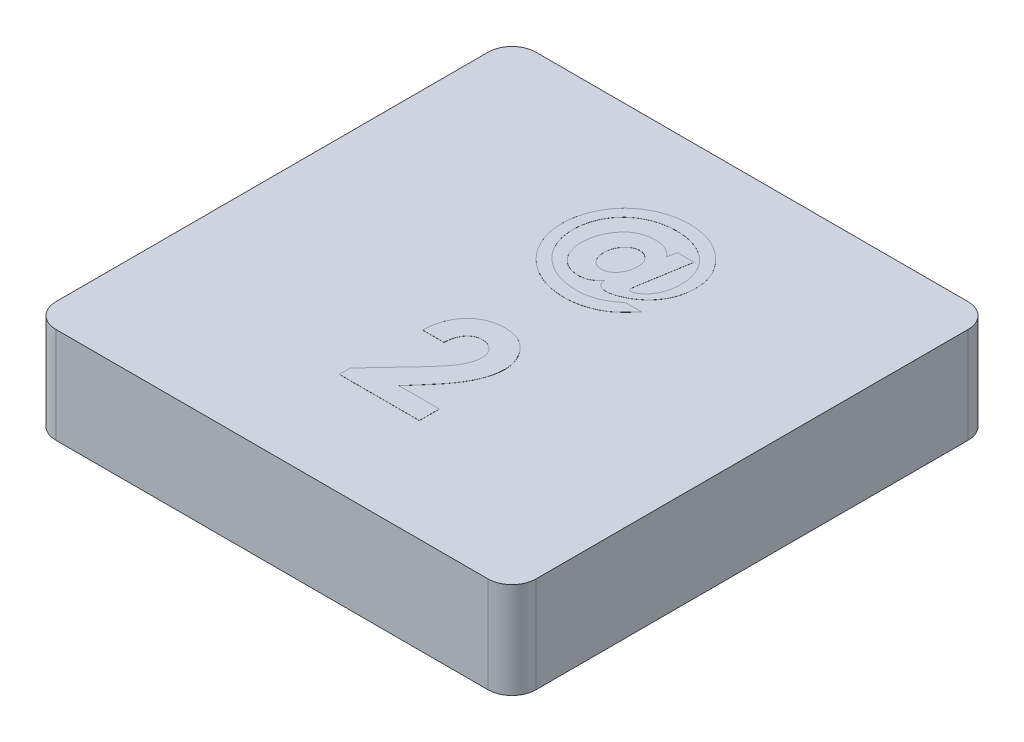
from build123d import *

# Parameters (mm, degrees)
SKETCH1_W           = 12.7
SKETCH1_H           = 12.7
BOSS_EXTRUDE1_DEPTH = 2.54
FILLET1_R           = 0.635
SHELL1_START        = 0.635
SHELL1_OUTLINE_W    = 1.905
SHELL1_OUTLINE_H    = 11.43
SHELL1_DEPTH        = 11.43
SKETCH2_R           = 2.54
BOSS_EXTRUDE2_DEPTH = 1.905
BOSS_EXTRUDE4_DEPTH = 0.00254


# Read off the part's stored shape, not the designer's step: Shell1
with BuildPart() as part:
    # Sketch1 → Boss-Extrude1 (new body)
    with BuildSketch(Plane(origin=(0, 0, 0), x_dir=(1, 0, 0), z_dir=(0, 1, 0))):
        with Locations((6.35, 6.35)):
            Rectangle(SKETCH1_W, SKETCH1_H)
    extrude(amount=BOSS_EXTRUDE1_DEPTH)

    # Fillet1
    fillet1_edges = [part.edges().sort_by_distance(p)[0] for p in [
        (0, 1.27, -12.7),
        (12.7, 1.27, -12.7),
        (12.7, 1.27, 0),
        (0, 1.27, 0),
    ]]
    fillet(fillet1_edges, radius=FILLET1_R)

    # Shell1 outline → Shell1 (cut)
    with BuildSketch(Plane.YZ.offset(SHELL1_START)):
        with Locations((0.9525, -6.35)):
            Rectangle(SHELL1_OUTLINE_W, SHELL1_OUTLINE_H)
    extrude(amount=SHELL1_DEPTH, mode=Mode.SUBTRACT)

    # Sketch2 → Boss-Extrude2 (add)
    with BuildSketch(Plane(origin=(0, 1.905, 0), x_dir=(-1, 0, 0), z_dir=(0, -1, 0))):
        with Locations(Location((-6.35, 6.35, 0), (0, 0, 270))):
            Circle(SKETCH2_R)
    extrude(amount=BOSS_EXTRUDE2_DEPTH)

    # Sketch4 → Boss-Extrude4 (add)
    # profile 1 of 2: a face of its own
    with BuildSketch(Plane(origin=(0, 2.54, 0), x_dir=(1, 0, 0), z_dir=(0, 1, 0))):
        with BuildLine():
            Line((6.066692308, 4.834466667), (5.496820513, 4.834466667))
            add(Edge.make_bspline(
                [(5.496820513, 4.834466667), (5.499281702, 4.877574453), (5.504090717, 4.96180448), (5.523219764, 5.08415129), (5.548852032, 5.199755572), (5.583061695, 5.30821293), (5.626048375, 5.409483952), (5.676705914, 5.503913879), (5.736328497, 5.591005533), (5.803647159, 5.670338911), (5.877519015, 5.741509616), (5.956410412, 5.804614034), (6.041528101, 5.856686212), (6.131316912, 5.899536794), (6.225761556, 5.933772417), (6.325755626, 5.956661702), (6.430433321, 5.97216255), (6.50209368, 5.973518936), (6.538617388, 5.974210256)],
                knots=[0, 0, 0, 0, 1.199038563, 2.342849363, 3.436047546, 4.486744587, 5.497670872, 6.488682221, 7.459191391, 8.424610317, 9.374430501, 10.305433194, 11.225809216, 12.140057399, 13.06607119, 14.010487599, 14.985989317, 16, 16, 16, 16], degree=3))
            add(Edge.make_bspline(
                [(6.538617388, 5.974210256), (6.583449721, 5.972811369), (6.670972941, 5.970080414), (6.798151123, 5.94678446), (6.91692164, 5.907818376), (7.027198156, 5.853372481), (7.128041868, 5.784204679), (7.219436055, 5.701733395), (7.298616809, 5.604228338), (7.36608616, 5.495746535), (7.422145128, 5.380879574), (7.461428917, 5.262102372), (7.487249728, 5.142566795), (7.490003678, 5.062077588), (7.491371795, 5.022091867)],
                knots=[0, 0, 0, 0, 1.075374347, 2.099382735, 3.09057751, 4.06680945, 5.040638231, 6.016817125, 7.011024321, 8.044445721, 9.0776792, 10.070479129, 11.0414456, 12, 12, 12, 12], degree=3))
            add(Edge.make_bspline(
                [(7.491371795, 5.022091867), (7.490839122, 4.997905677), (7.489766984, 4.94922485), (7.482312265, 4.875558812), (7.471128713, 4.800521339), (7.454266642, 4.724176769), (7.433238257, 4.646503702), (7.407727787, 4.567269689), (7.377143491, 4.486923958), (7.341995759, 4.40456223), (7.300064426, 4.319917111), (7.251241216, 4.231719737), (7.194230253, 4.140048345), (7.129720155, 4.04438533), (7.057397613, 3.944881566), (6.976909573, 3.841836789), (6.889183066, 3.734887904), (6.826921097, 3.663398577), (6.794932492, 3.626669191)],
                knots=[0, 0, 0, 0, 0.728284026, 1.46585585, 2.227944881, 3.01186502, 3.81876927, 4.650621989, 5.517437689, 6.406905708, 7.346299482, 8.360816762, 9.441613733, 10.596154504, 11.834900912, 13.145207542, 14.533280747, 16, 16, 16, 16], degree=3))
            Line((6.794932492, 3.626669191), (6.463567308, 3.246966667))
            Line((6.463567308, 3.246966667), (7.532076923, 3.246966667))
            Line((7.532076923, 3.246966667), (7.532076923, 2.7178))
            Line((7.532076923, 2.7178), (5.415410256, 2.7178))
            Line((5.415410256, 2.7178), (5.415410256, 3.006552003))
            Line((5.415410256, 3.006552003), (6.355444311, 4.007007732))
            add(Edge.make_bspline(
                [(6.355444311, 4.007007732), (6.382660712, 4.036191337), (6.435370811, 4.092711324), (6.510371849, 4.175716937), (6.578241164, 4.254487284), (6.637571429, 4.329861108), (6.691476221, 4.399393589), (6.737551929, 4.465180524), (6.77622011, 4.526627174), (6.818199905, 4.600721103), (6.85806691, 4.689091298), (6.8946473, 4.790897387), (6.916945579, 4.88820056), (6.920023447, 4.9516054), (6.9215, 4.982022756)],
                knots=[0, 0, 0, 0, 1.246127091, 2.413378631, 3.493388633, 4.492180848, 5.408488754, 6.240484944, 6.999099869, 7.674939598, 8.898438119, 10.020720584, 11.050475521, 12, 12, 12, 12], degree=3))
            add(Edge.make_bspline(
                [(6.9215, 4.982022756), (6.920396017, 5.011449202), (6.918256873, 5.068467658), (6.894749415, 5.149576109), (6.858330846, 5.223011531), (6.807011938, 5.286579591), (6.744848668, 5.338817682), (6.67301317, 5.377670906), (6.592091116, 5.400089038), (6.535363213, 5.402894988), (6.506180489, 5.404338462)],
                knots=[0, 0, 0, 0, 1.062038974, 2.057870785, 3.028805853, 4.01125022, 4.991535629, 5.949134679, 6.94496649, 8, 8, 8, 8], degree=3))
            add(Edge.make_bspline(
                [(6.506180489, 5.404338462), (6.491104322, 5.403805225), (6.461424465, 5.402755463), (6.417797396, 5.395767483), (6.376283106, 5.383451898), (6.336419517, 5.366950747), (6.298632063, 5.345078353), (6.263016058, 5.318117143), (6.229196241, 5.286752262), (6.197327724, 5.251081784), (6.168323213, 5.21127352), (6.142561513, 5.167691037), (6.121260875, 5.120361389), (6.102507019, 5.069909398), (6.088043148, 5.01579317), (6.077511656, 4.958336583), (6.069505266, 4.897633113), (6.067647018, 4.855905185), (6.066692308, 4.834466667)],
                knots=[0, 0, 0, 0, 0.903469896, 1.778625579, 2.63899355, 3.493148037, 4.358286772, 5.247621495, 6.164656832, 7.118446693, 8.109501108, 9.111810964, 10.146451449, 11.215617525, 12.33435995, 13.498009769, 14.714554818, 16, 16, 16, 16], degree=3))
        make_face()
    # profile 2 of 2: a face of its own
    with BuildSketch(Plane(origin=(0, 2.54, 0), x_dir=(1, 0, 0), z_dir=(0, 1, 0))):
        with BuildLine():
            Line((7.55439351, 8.144282051), (7.975437179, 8.144282051))
            add(Edge.make_bspline(
                [(7.975437179, 8.144282051), (7.955996762, 8.121331158), (7.918110084, 8.07660305), (7.861705911, 8.01217647), (7.806370368, 7.953179289), (7.752788451, 7.8988085), (7.700867691, 7.849332195), (7.650654521, 7.804702005), (7.602086363, 7.764988278), (7.539437109, 7.718310581), (7.457980048, 7.666557671), (7.35451738, 7.611819495), (7.242979501, 7.564939987), (7.125576983, 7.524452087), (7.00300916, 7.491807112), (6.877035655, 7.469419651), (6.748700342, 7.454614085), (6.662314197, 7.453071627), (6.618811579, 7.452294872)],
                knots=[0, 0, 0, 0, 0.912106962, 1.777569995, 2.59630641, 3.364595681, 4.09218467, 4.770774812, 5.401344362, 5.994106515, 7.139051617, 8.323895876, 9.539509699, 10.804118058, 12.087510927, 13.381328277, 14.681280706, 16, 16, 16, 16], degree=3))
            add(Edge.make_bspline(
                [(6.618811579, 7.452294872), (6.580195298, 7.45276655), (6.503653902, 7.453701466), (6.390104653, 7.465431993), (6.278601893, 7.481850159), (6.169436344, 7.507433102), (6.061960048, 7.538112403), (5.956674231, 7.576642427), (5.853520784, 7.621648465), (5.753378304, 7.674088829), (5.656204721, 7.731227914), (5.564805828, 7.795134809), (5.478418418, 7.863357903), (5.397521404, 7.93671783), (5.321616835, 8.014890291), (5.251585155, 8.098657969), (5.186496448, 8.187053099), (5.127689696, 8.280297637), (5.074974211, 8.377033517), (5.028301057, 8.476000966), (4.989439771, 8.577692038), (4.957628784, 8.681404382), (4.932819223, 8.787227555), (4.914819234, 8.894907612), (4.904690977, 9.004831133), (4.90303564, 9.078784293), (4.9022, 9.116116987)],
                knots=[0, 0, 0, 0, 1.044838649, 2.070976499, 3.087132743, 4.093650166, 5.103434239, 6.1109818, 7.126019313, 8.147573546, 9.169160017, 10.175251997, 11.163809779, 12.147022884, 13.129163562, 14.110817912, 15.100224835, 16.098462891, 17.092320042, 18.0807279, 19.0580281, 20.03645652, 21.015019567, 21.998081932, 22.989400915, 24, 24, 24, 24], degree=3))
            add(Edge.make_bspline(
                [(4.9022, 9.116116987), (4.903049124, 9.153660645), (4.904740795, 9.228457163), (4.914772012, 9.339656038), (4.932810298, 9.448819021), (4.957670385, 9.555888655), (4.989344713, 9.661220113), (5.029104688, 9.764015127), (5.07496353, 9.865346702), (5.128324541, 9.96365894), (5.186863328, 10.059104345), (5.252296835, 10.14857857), (5.321354117, 10.233840113), (5.396690623, 10.312425864), (5.476569498, 10.386178584), (5.561791017, 10.454215136), (5.652530795, 10.516552725), (5.747533945, 10.573802637), (5.846765657, 10.624297793), (5.948372512, 10.669426487), (6.053190285, 10.705569962), (6.159586205, 10.737735882), (6.269083435, 10.76055878), (6.380489034, 10.77798679), (6.494373843, 10.788471291), (6.571088659, 10.789562977), (6.609907332, 10.790115385)],
                knots=[0, 0, 0, 0, 1.014317886, 2.020779267, 3.013193412, 4.000969308, 4.988413066, 5.981867833, 6.976312655, 7.991067026, 9.001886247, 9.998588011, 10.983453909, 11.963813152, 12.936614909, 13.918729197, 14.906886913, 15.908758709, 16.912854418, 17.913087829, 18.909378123, 19.90616216, 20.913796156, 21.92793616, 22.95150933, 24, 24, 24, 24], degree=3))
            add(Edge.make_bspline(
                [(6.609907332, 10.790115385), (6.663190054, 10.789016261), (6.768013298, 10.786853952), (6.921780872, 10.766134315), (7.069513637, 10.734938302), (7.210822383, 10.689565844), (7.345649262, 10.630508528), (7.474520818, 10.559325791), (7.596559941, 10.474657184), (7.710785807, 10.378715499), (7.814499862, 10.273919371), (7.907125013, 10.1647002), (7.984358426, 10.049877152), (8.048777324, 9.931376737), (8.097829637, 9.807842079), (8.132999069, 9.680348772), (8.154668307, 9.548713657), (8.157288681, 9.459436067), (8.158610256, 9.414409255)],
                knots=[0, 0, 0, 0, 1.112384749, 2.188397543, 3.235022914, 4.262941595, 5.282268234, 6.305080615, 7.33321866, 8.379881503, 9.41633992, 10.409701185, 11.36648018, 12.301637889, 13.221808093, 14.136077516, 15.059937794, 16, 16, 16, 16], degree=3))
            add(Edge.make_bspline(
                [(8.158610256, 9.414409255), (8.157971523, 9.381527938), (8.156712297, 9.316704311), (8.147577337, 9.221104553), (8.133075843, 9.128885518), (8.112948252, 9.040109079), (8.085937567, 8.955181884), (8.053415564, 8.873572825), (8.015509066, 8.794989777), (7.970540231, 8.720925763), (7.921840636, 8.650103288), (7.867831573, 8.583733559), (7.810258415, 8.520873448), (7.748139608, 8.461821299), (7.681542961, 8.407560804), (7.610803493, 8.35682861), (7.536245736, 8.309677769), (7.483574418, 8.282150583), (7.457082812, 8.268305489)],
                knots=[0, 0, 0, 0, 1.11071627, 2.189713314, 3.241213933, 4.262798775, 5.261737586, 6.248587015, 7.22876036, 8.205263417, 9.172821461, 10.130306884, 11.093401214, 12.050913425, 13.022993843, 13.992961155, 14.990538226, 16, 16, 16, 16], degree=3))
            add(Edge.make_bspline(
                [(7.457082812, 8.268305489), (7.436838242, 8.258313345), (7.397590358, 8.238941708), (7.338809772, 8.21473118), (7.283490356, 8.192205429), (7.229873505, 8.17559724), (7.179187987, 8.160973915), (7.130637519, 8.151639503), (7.084748011, 8.145471863), (7.054925826, 8.144670114), (7.040491266, 8.144282051)],
                knots=[0, 0, 0, 0, 1.235872996, 2.395970773, 3.480405153, 4.504758683, 5.468013059, 6.367370585, 7.209773281, 8, 8, 8, 8], degree=3))
            add(Edge.make_bspline(
                [(7.040491266, 8.144282051), (7.020280412, 8.145145097), (6.981796998, 8.14678842), (6.927038526, 8.158979864), (6.878198293, 8.179680067), (6.851004338, 8.200702752), (6.837601643, 8.211063902)],
                knots=[0, 0, 0, 0, 1.111040528, 2.115528298, 3.071227409, 4, 4, 4, 4], degree=3))
            add(Edge.make_bspline(
                [(6.837601643, 8.211063902), (6.828318114, 8.219938433), (6.808954889, 8.238448584), (6.790484935, 8.277195546), (6.778410498, 8.323351892), (6.775955744, 8.357042204), (6.774635897, 8.37515645)],
                knots=[0, 0, 0, 0, 0.84582962, 1.764198658, 2.79787821, 4, 4, 4, 4], degree=3))
            add(Edge.make_bspline(
                [(6.774635897, 8.37515645), (6.758654308, 8.356811909), (6.727384737, 8.320918988), (6.675670892, 8.273664459), (6.621213921, 8.233877386), (6.564273137, 8.201238009), (6.504691124, 8.175241892), (6.442134783, 8.157853636), (6.377322293, 8.146502981), (6.333287947, 8.145028872), (6.310979046, 8.144282051)],
                knots=[0, 0, 0, 0, 1.088483012, 2.129725465, 3.128222847, 4.101736138, 5.062537219, 6.029831694, 7.00186351, 8, 8, 8, 8], degree=3))
            add(Edge.make_bspline(
                [(6.310979046, 8.144282051), (6.285908879, 8.144722648), (6.23658244, 8.145589538), (6.164390109, 8.157537333), (6.094715363, 8.173043414), (6.028964867, 8.198034006), (5.96582338, 8.228280944), (5.907022263, 8.267100116), (5.850188874, 8.311049831), (5.797853388, 8.36239808), (5.750581106, 8.419590742), (5.707812893, 8.480740232), (5.672990642, 8.547420823), (5.644457878, 8.618472598), (5.62119355, 8.693661277), (5.605647648, 8.773840739), (5.595921929, 8.858287962), (5.594772793, 8.916167945), (5.594187179, 8.945664263)],
                knots=[0, 0, 0, 0, 0.996320099, 1.960294912, 2.905596313, 3.831732669, 4.752281366, 5.685917543, 6.629259612, 7.607596653, 8.595884673, 9.578648765, 10.57110437, 11.581503045, 12.622224914, 13.697585308, 14.826662513, 16, 16, 16, 16], degree=3))
            add(Edge.make_bspline(
                [(5.594187179, 8.945664263), (5.594848162, 8.978564548), (5.59615766, 9.043744636), (5.608819753, 9.140099051), (5.628480487, 9.233903061), (5.655643283, 9.325176553), (5.691721207, 9.413299354), (5.735113413, 9.498810303), (5.786232877, 9.581872339), (5.844724301, 9.661212642), (5.909583731, 9.734732972), (5.980364369, 9.799782833), (6.057267935, 9.85373483), (6.138595494, 9.899186559), (6.225636925, 9.933166569), (6.317431519, 9.958394328), (6.414603806, 9.973045042), (6.481171124, 9.975010062), (6.515140705, 9.976012821)],
                knots=[0, 0, 0, 0, 1.025111528, 2.030889939, 3.023731756, 4.010572873, 4.994799368, 5.987861107, 6.996631301, 8.031579918, 9.056776652, 10.04856216, 11.020396719, 11.978745493, 12.945782063, 13.925338154, 14.941291368, 16, 16, 16, 16], degree=3))
            add(Edge.make_bspline(
                [(6.515140705, 9.976012821), (6.542946661, 9.975252192), (6.597291137, 9.973765606), (6.676431172, 9.962991125), (6.751076565, 9.944427457), (6.821063305, 9.918395894), (6.886691738, 9.885055119), (6.947365756, 9.844335551), (7.002837617, 9.795413965), (7.0349878, 9.757844314), (7.051303566, 9.738778245)],
                knots=[0, 0, 0, 0, 1.098159564, 2.14626338, 3.147557258, 4.130615999, 5.089370286, 6.048599882, 7.009691885, 8, 8, 8, 8], degree=3))
            Line((7.051303566, 9.738778245), (7.09836887, 9.976012821))
            Line((7.09836887, 9.976012821), (7.539129087, 9.976012821))
            Line((7.539129087, 9.976012821), (7.325427163, 8.690621194))
            add(Edge.make_bspline(
                [(7.325427163, 8.690621194), (7.322090338, 8.670290093), (7.31625716, 8.634748848), (7.310579815, 8.588596475), (7.30518998, 8.557585421), (7.304158481, 8.541588595), (7.303802564, 8.53606891)],
                knots=[0, 0, 0, 0, 1.583583446, 2.768297005, 3.575002465, 4, 4, 4, 4], degree=3))
            add(Edge.make_bspline(
                [(7.303802564, 8.53606891), (7.305057945, 8.527948507), (7.307724415, 8.510700509), (7.325811236, 8.489452653), (7.349921022, 8.472641179), (7.369677101, 8.470825037), (7.379488662, 8.469923077)],
                knots=[0, 0, 0, 0, 0.88088808, 1.871034604, 2.942681205, 4, 4, 4, 4], degree=3))
            add(Edge.make_bspline(
                [(7.379488662, 8.469923077), (7.393420138, 8.471411568), (7.424463359, 8.474728342), (7.472732224, 8.496059982), (7.526370161, 8.529295673), (7.586239724, 8.572909382), (7.646686191, 8.62920739), (7.701857056, 8.698783561), (7.752021138, 8.779007313), (7.794130134, 8.870069468), (7.830010623, 8.968596214), (7.855037379, 9.073151868), (7.870928226, 9.182198801), (7.872747724, 9.256408409), (7.873674359, 9.294201923)],
                knots=[0, 0, 0, 0, 0.485661064, 1.082188592, 1.81421814, 2.685658827, 3.657430019, 4.681580438, 5.769658718, 6.94567912, 8.169690259, 9.416304784, 10.68417414, 12, 12, 12, 12], degree=3))
            add(Edge.make_bspline(
                [(7.873674359, 9.294201923), (7.873122103, 9.322409211), (7.872032499, 9.378062323), (7.865297927, 9.460369246), (7.852253222, 9.539944677), (7.835104618, 9.617041879), (7.813676504, 9.69206705), (7.786159094, 9.764151243), (7.754390269, 9.834019003), (7.717212331, 9.900744011), (7.676211201, 9.965005755), (7.630227169, 10.025398998), (7.580105039, 10.082585912), (7.525906926, 10.136411387), (7.466773229, 10.185986807), (7.404403864, 10.233050575), (7.336718332, 10.275144778), (7.265571606, 10.314799709), (7.191015729, 10.350080375), (7.113429344, 10.38121888), (7.032739153, 10.405859265), (6.949783353, 10.428148478), (6.864089416, 10.444406651), (6.775518243, 10.455798317), (6.684436808, 10.462895308), (6.62264036, 10.463944846), (6.591462821, 10.464474359)],
                knots=[0, 0, 0, 0, 1.040927254, 2.053754399, 3.044065012, 4.013925682, 4.967078454, 5.920231225, 6.858369721, 7.796769119, 8.736374247, 9.668885693, 10.594678859, 11.540613114, 12.484182975, 13.44015668, 14.42115382, 15.422617935, 16.444408593, 17.462749525, 18.504382055, 19.555576815, 20.631087687, 21.719804181, 22.849595764, 24, 24, 24, 24], degree=3))
            add(Edge.make_bspline(
                [(6.591462821, 10.464474359), (6.558583852, 10.464045603), (6.493355344, 10.463194995), (6.396954898, 10.454593458), (6.302911701, 10.441192945), (6.21144004, 10.423103782), (6.12274007, 10.398661397), (6.036575591, 10.36921014), (5.952559343, 10.335283092), (5.871956079, 10.294828238), (5.79441, 10.250630996), (5.720826817, 10.20163966), (5.652302001, 10.14717597), (5.587096956, 10.089218019), (5.525887361, 10.027108704), (5.469835826, 9.959731391), (5.417641927, 9.888327962), (5.369269338, 9.813223222), (5.32714233, 9.734187086), (5.289066943, 9.653633352), (5.258315005, 9.570414765), (5.231650585, 9.485917772), (5.212457925, 9.398985378), (5.197282397, 9.310338298), (5.189326, 9.219508757), (5.18786845, 9.158318857), (5.187135897, 9.127565304)],
                knots=[0, 0, 0, 0, 1.09139603, 2.165218013, 3.21044449, 4.244399487, 5.258712678, 6.262616842, 7.266496329, 8.264385998, 9.254449743, 10.228622201, 11.196032238, 12.158204111, 13.123845595, 14.088177805, 15.065244983, 16.059129694, 17.051218137, 18.036918468, 19.014821992, 19.994471931, 20.976319446, 21.968033256, 22.978749797, 24, 24, 24, 24], degree=3))
            add(Edge.make_bspline(
                [(5.187135897, 9.127565304), (5.187854419, 9.096173908), (5.189279317, 9.033921676), (5.197404966, 8.941430882), (5.21216449, 8.851164377), (5.23245278, 8.763164311), (5.258727843, 8.677569287), (5.290419587, 8.594189702), (5.328276194, 8.51313252), (5.371226003, 8.434269659), (5.420233471, 8.359193512), (5.472986018, 8.287365382), (5.531035034, 8.220348931), (5.594362592, 8.158323827), (5.661120329, 8.099208185), (5.733194625, 8.045278384), (5.809865129, 7.995670168), (5.890367914, 7.949818893), (5.974739173, 7.909238055), (6.062191545, 7.874349665), (6.151730746, 7.84430914), (6.243992583, 7.820176377), (6.338455731, 7.800990387), (6.435775357, 7.787885369), (6.535334253, 7.779199287), (6.602680522, 7.778359243), (6.636620072, 7.777935897)],
                knots=[0, 0, 0, 0, 1.019428582, 2.021627332, 3.01190987, 3.987122772, 4.95180652, 5.917079598, 6.881099919, 7.854659174, 8.830406479, 9.790066312, 10.746585184, 11.705553405, 12.666594966, 13.640008177, 14.625277079, 15.630285463, 16.646361418, 17.662647236, 18.685811233, 19.711057421, 20.757373217, 21.813696226, 22.898199286, 24, 24, 24, 24], degree=3))
            add(Edge.make_bspline(
                [(6.636620072, 7.777935897), (6.676531803, 7.778840953), (6.75561918, 7.780634371), (6.872286072, 7.797159482), (6.985698517, 7.823374285), (7.097359694, 7.859866277), (7.20895052, 7.909855444), (7.322070374, 7.974286596), (7.439239485, 8.0519086), (7.515010898, 8.112690383), (7.55439351, 8.144282051)],
                knots=[0, 0, 0, 0, 0.947837634, 1.878194511, 2.79337344, 3.710878254, 4.664719902, 5.693133815, 6.800993507, 8, 8, 8, 8], degree=3))
        make_face()
        with BuildLine():
            add(Edge.make_bspline(
                [(6.473163542, 8.592038462), (6.488035296, 8.592525742), (6.517553232, 8.593492913), (6.560744535, 8.601243819), (6.601979356, 8.614078743), (6.641081285, 8.632062963), (6.67821421, 8.655186573), (6.713362844, 8.683437342), (6.746549086, 8.716774777), (6.78767748, 8.767530773), (6.831309869, 8.837512769), (6.869362603, 8.928309459), (6.892432293, 9.024661513), (6.895295079, 9.090762069), (6.896751282, 9.124385216)],
                knots=[0, 0, 0, 0, 0.710514298, 1.410251571, 2.089736825, 2.769901828, 3.461668832, 4.17542767, 4.920648913, 5.705665255, 7.294358887, 8.843253591, 10.394268435, 12, 12, 12, 12], degree=3))
            add(Edge.make_bspline(
                [(6.896751282, 9.124385216), (6.895519269, 9.152882598), (6.893157466, 9.207512861), (6.875410028, 9.285868186), (6.843638901, 9.355326049), (6.801062357, 9.416107705), (6.749182778, 9.465704604), (6.689950121, 9.502823879), (6.623437235, 9.524423778), (6.576987323, 9.526962086), (6.553301763, 9.52825641)],
                knots=[0, 0, 0, 0, 1.154387065, 2.212991665, 3.231842362, 4.230536812, 5.202794393, 6.120739433, 7.041734666, 8, 8, 8, 8], degree=3))
            add(Edge.make_bspline(
                [(6.553301763, 9.52825641), (6.539071394, 9.527717559), (6.510864035, 9.526649452), (6.469363703, 9.51964019), (6.429382265, 9.507438356), (6.391052395, 9.489758047), (6.353350535, 9.468444971), (6.317759105, 9.441396292), (6.283708814, 9.40965147), (6.240206786, 9.362066198), (6.193270638, 9.294601019), (6.152806409, 9.204035056), (6.127859203, 9.105143347), (6.12488275, 9.03633983), (6.123353846, 9.000997796)],
                knots=[0, 0, 0, 0, 0.680663477, 1.349207348, 2.006816805, 2.674051842, 3.364615308, 4.074492284, 4.8064802, 5.588923708, 7.155813855, 8.712695607, 10.311423162, 12, 12, 12, 12], degree=3))
            add(Edge.make_bspline(
                [(6.123353846, 9.000997796), (6.124584306, 8.971652145), (6.126945268, 8.915344742), (6.144640983, 8.835007415), (6.175474149, 8.76402799), (6.217645004, 8.7028648), (6.269948445, 8.653269985), (6.331115212, 8.617611455), (6.399830065, 8.59562175), (6.448191171, 8.593258685), (6.473163542, 8.592038462)],
                knots=[0, 0, 0, 0, 1.164968287, 2.235300111, 3.245807089, 4.219769162, 5.166866278, 6.083843216, 7.010548299, 8, 8, 8, 8], degree=3))
        make_face(mode=Mode.SUBTRACT)
    extrude(amount=BOSS_EXTRUDE4_DEPTH)


solid = part.part
